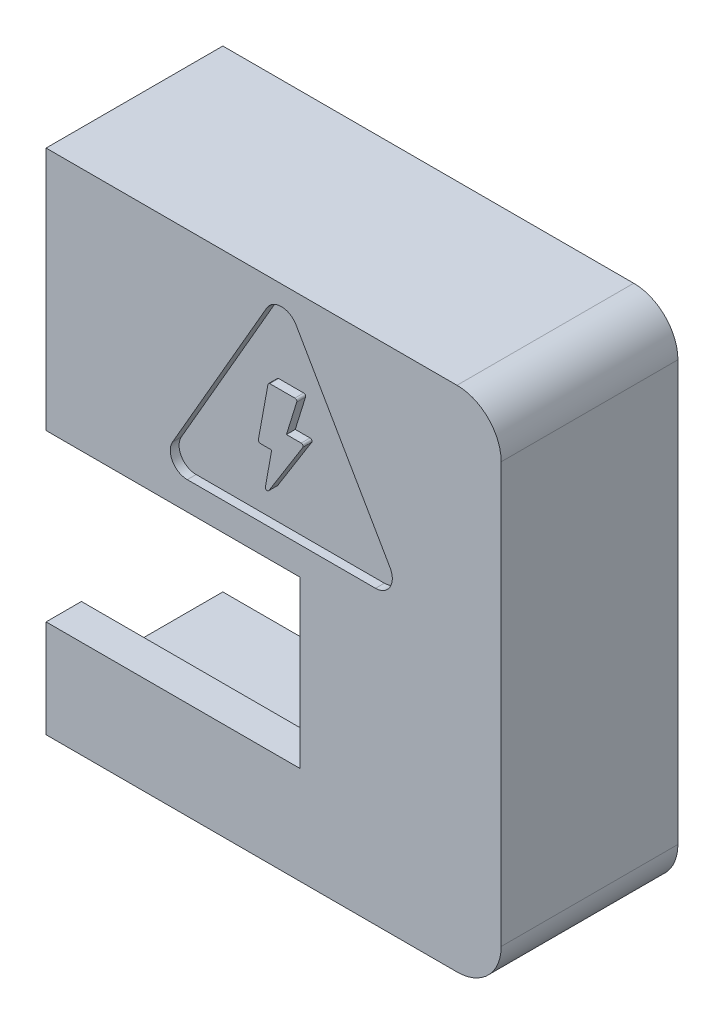
from build123d import *

# Parameters (mm, degrees)
ESQUISSE1_W             = 8
ESQUISSE1_H             = 23
BOSS_EXTRU_1_DEPTH      = 1.6
ESQUISSE2_W             = 2.4
ESQUISSE2_H             = 10
BOSS_EXTRU_2_DEPTH      = 19
ESQUISSE3_W             = 2.4
ESQUISSE3_H             = 19.8
BOSS_EXTRU_3_DEPTH      = 5
ENL_V_MAT_EXTRU_1_REACH = 25.606
ESQUISSE4_W             = 11.5
ESQUISSE4_H             = 7.5
ENL_V_START             = -0.4
ENL_V_MAT_EXTRU_2_DEPTH = 0.4
CONG_1_R                = 2


# Read off the part's stored shape, not the designer's step: Enlèv. mat.-Extru.2
with BuildPart() as part:
    # Esquisse1 → Boss.-Extru.1 (new body)
    with BuildSketch(Plane(origin=(0, 0, 0), x_dir=(0, 0, -1), z_dir=(1, 0, 0))):
        Rectangle(ESQUISSE1_W, ESQUISSE1_H)
    extrude(amount=BOSS_EXTRU_1_DEPTH)

    # Esquisse2 → Boss.-Extru.2 (add)
    with BuildSketch(Plane.ZY):
        Polygon((-4, 11.5), (4, 11.5), (4, -11.5), (-4, -11.5), (-4, -9.9), (2.4, -9.9), (2.4, 9.9), (-4, 9.9), align=None)
        with Locations((-2.8, 0)):
            Rectangle(ESQUISSE2_W, ESQUISSE2_H)
    extrude(amount=BOSS_EXTRU_2_DEPTH)

    # Esquisse3 → Boss.-Extru.3 (add)
    with BuildSketch(Plane.ZY):
        with Locations((-2.8, 0)):
            Rectangle(ESQUISSE3_W, ESQUISSE3_H)
    extrude(amount=BOSS_EXTRU_3_DEPTH)

    # Esquisse4 → Enlèv. mat.-Extru.1 (cut, up to next)
    with BuildSketch(Plane.XY.offset(4), mode=Mode.PRIVATE) as enl_v_mat_extru_1_sk1:
        with Locations((-13.25, -3.325)):
            Rectangle(ESQUISSE4_W, ESQUISSE4_H)
    enl_v_mat_extru_1_tool1 = extrude(enl_v_mat_extru_1_sk1.sketch, amount=-ENL_V_MAT_EXTRU_1_REACH, mode=Mode.PRIVATE) & part.part
    add(enl_v_mat_extru_1_tool1.solids().sort_by_distance((-13.25, -3.325, 4))[0], mode=Mode.SUBTRACT)

    # Enlèv. mat.-Extru.2 outline → Enlèv. mat.-Extru.2 (cut)
    with BuildSketch(Plane.XY.offset(4).offset(ENL_V_START)):
        with BuildLine():
            Line((-12.608271193, 1.69730271), (-4.088687559, 1.69730271))
            add(Edge.make_bspline(
                [(-4.088687559, 1.69730271), (-3.506604225, 1.697303518), (-3.136187559, 2.332303518), (-3.432521215, 2.840303033)],
                knots=[5, 5, 5, 5, 6, 6, 6, 6], degree=3))
            Line((-3.432521215, 2.840303033), (-7.687021295, 10.227470021))
            add(Edge.make_bspline(
                [(-7.687021295, 10.227470021), (-7.983354547, 10.735470041), (-8.713604709, 10.735470041), (-9.009937961, 10.227470021)],
                knots=[1, 1, 1, 1, 2, 2, 2, 2], degree=3))
            Line((-9.009937961, 10.227470021), (-13.275021213, 2.840303033))
            add(Edge.make_bspline(
                [(-13.275021213, 2.840303033), (-13.571354541, 2.33230271), (-13.200937899, 1.69730271), (-12.608271193, 1.69730271)],
                knots=[3, 3, 3, 3, 4, 4, 4, 4], degree=3))
        make_face()
        with BuildLine():
            add(Edge.make_bspline(
                [(-7.380104467, 5.570803355), (-7.337771376, 5.623720022), (-7.380104467, 5.708386608), (-7.454188284, 5.708387012)],
                knots=[11, 11, 11, 11, 12, 12, 12, 12], degree=3))
            Line((-7.380104467, 5.570803355), (-8.9146878, 3.115470345))
            add(Edge.make_bspline(
                [(-9.0734378, 3.178970184), (-9.094604547, 3.083720023), (-8.967604466, 3.030803356), (-8.9146878, 3.115470345)],
                knots=[1, 1, 1, 1, 2, 2, 2, 2], degree=3))
            Line((-9.0734378, 3.178970184), (-8.787687719, 4.766470184))
            Line((-8.787687719, 4.766470184), (-9.306271214, 4.766470184))
            add(Edge.make_bspline(
                [(-9.390937799, 4.872303517), (-9.401521375, 4.81938685), (-9.35918788, 4.766470184), (-9.306271214, 4.766470184)],
                knots=[4, 4, 4, 4, 5, 5, 5, 5], degree=3))
            Line((-9.390937799, 4.872303517), (-8.957021294, 7.253553516))
            add(Edge.make_bspline(
                [(-8.872354708, 7.32763693), (-8.9146878, 7.32763693), (-8.946438123, 7.295887011), (-8.957021294, 7.253553516)],
                knots=[6, 6, 6, 6, 7, 7, 7, 7], degree=3))
            Line((-8.872354708, 7.32763693), (-7.739937961, 7.32763693))
            add(Edge.make_bspline(
                [(-7.655271375, 7.211220425), (-7.634104628, 7.274720264), (-7.676438123, 7.32763693), (-7.739937961, 7.32763693)],
                knots=[8, 8, 8, 8, 9, 9, 9, 9], degree=3))
            Line((-7.655271375, 7.211220425), (-8.120938204, 5.708387012))
            Line((-8.120938204, 5.708387012), (-7.454188284, 5.708387012))
        make_face(mode=Mode.SUBTRACT)
    extrude(amount=ENL_V_MAT_EXTRU_2_DEPTH, mode=Mode.SUBTRACT)

    # Congé1
    cong_1_edges = [part.edges().sort_by_distance(p)[0] for p in [
        (1.6, -11.5, 0),
        (1.6, 11.5, 0),
    ]]
    fillet(cong_1_edges, radius=CONG_1_R)


solid = part.part
